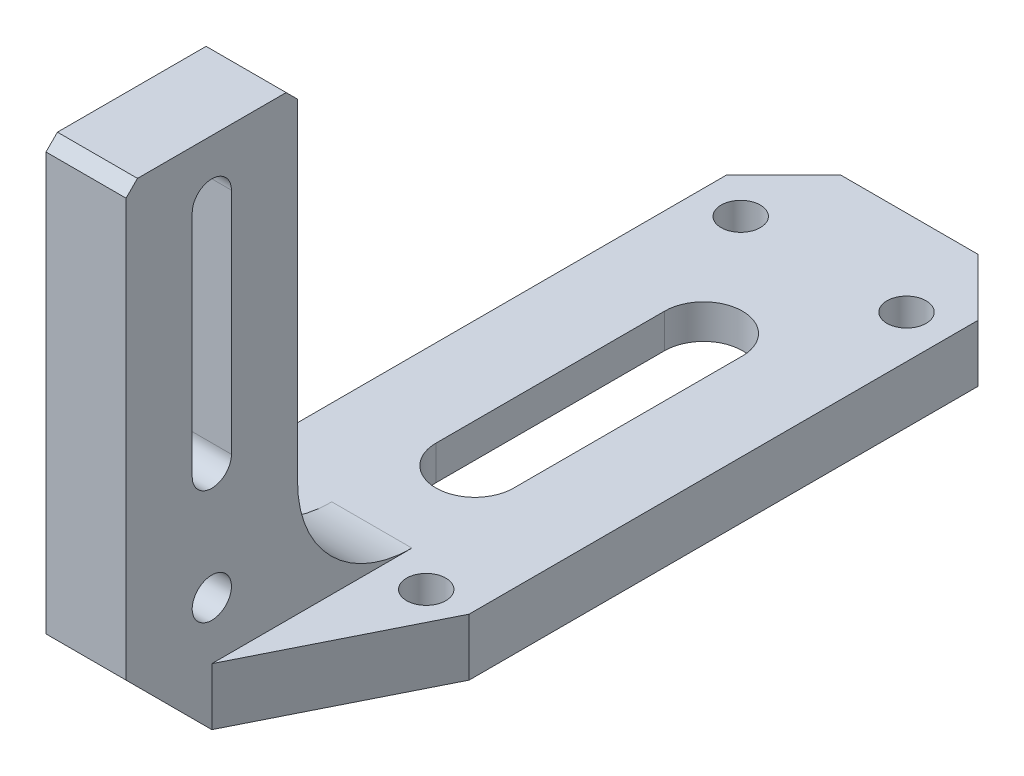
from build123d import *
from OCP.BRepFilletAPI import BRepFilletAPI_MakeChamfer

# Parameters (mm, degrees)
SKETCH1_W           = 22
SKETCH1_H           = 72
BOSS_EXTRUDE1_DEPTH = 5
SKETCH2_W           = 7
SKETCH2_H           = 15
BOSS_EXTRUDE2_DEPTH = 40
CHAMFER1_SIZE       = 1
FILLET1_R           = 10
CUT_EXTRUDE2_DEPTH  = 59.668560575
SKETCH6_W           = 7.5
SKETCH6_H           = 7.5
CUT_EXTRUDE3_DEPTH  = 55.927224579
CHAMFER2_SIZE2      = 15
CHAMFER2_SIZE       = 7.5
CHAMFER7_SIZE       = 7.5
CHAMFER3_SIZE       = 5
CUT_EXTRUDE6_DEPTH  = 2
CUT_EXTRUDE7_DEPTH  = 4
CHAMFER4_SIZE       = 2
CHAMFER4_SIZE_2     = 0.727940469
CUT_EXTRUDE8_DEPTH  = 60.42432162
CHAMFER8_SIZE2      = 7.5
CHAMFER8_SIZE       = 15
SKETCH12_R          = 1.7145
CUT_EXTRUDE9_DEPTH  = 60.42432162
SKETCH13_R          = 1.7145
CUT_EXTRUDE10_DEPTH = 55.927224579


with BuildPart() as part:
    # Sketch1 → Boss-Extrude1 (new body)
    with BuildSketch(Plane(origin=(0, 0, 0), x_dir=(1, 0, 0), z_dir=(0, 1, 0))):
        Rectangle(SKETCH1_W, SKETCH1_H)
    extrude(amount=BOSS_EXTRUDE1_DEPTH)

    # Sketch2 → Boss-Extrude2 (add)
    with BuildSketch(Plane(origin=(0, 5, 0), x_dir=(1, 0, 0), z_dir=(0, 1, 0))):
        with Locations((0, -28.5)):
            Rectangle(SKETCH2_W, SKETCH2_H)
    extrude(amount=BOSS_EXTRUDE2_DEPTH)

    # Chamfer1
    chamfer1_edges = [part.edges().sort_by_distance(p)[0] for p in [
        (0, 45, 36),
        (0, 45, 21),
    ]]
    chamfer(chamfer1_edges, length=CHAMFER1_SIZE)

    # Fillet1
    fillet1_edges = [part.edges().sort_by_distance(p)[0] for p in [
        (0, 5, 21),
    ]]
    fillet(fillet1_edges, radius=FILLET1_R)

    # Sketch5 → Cut-Extrude2 (cut, through all)
    with BuildSketch(Plane.XZ):
        with BuildLine():
            Line((3.4, 2), (3.4, -18))
            ThreePointArc((3.4, -18), (0, -21.4), (-3.4, -18))
            Line((-3.4, -18), (-3.4, 2))
            ThreePointArc((-3.4, 2), (0, 5.4), (3.4, 2))
        make_face()
    extrude(amount=-CUT_EXTRUDE2_DEPTH, mode=Mode.SUBTRACT)

    # Sketch6 → Cut-Extrude3 (cut, through all)
    with BuildSketch(Plane(origin=(0, 5, 0), x_dir=(1, 0, 0), z_dir=(0, 1, 0))):
        with Locations((7.25, -32.25)):
            Rectangle(SKETCH6_W, SKETCH6_H)
    cut_extrude3 = extrude(amount=-CUT_EXTRUDE3_DEPTH, mode=Mode.SUBTRACT)

    # Mirror1: Cut-Extrude3 across plane
    add(cut_extrude3.mirror(Plane(origin=(0, 0, 0), x_dir=(0, 0, 1), z_dir=(1, 0, 0))), mode=Mode.SUBTRACT)

    # Chamfer2
    chamfer2_edges = [part.edges().sort_by_distance(p)[0] for p in [
        (11, 2.5, 28.5),
    ]]
    chamfer2_side = [part.faces().sort_by_distance(p)[0] for p in [
        (10.85, 2.5, 28.5),
    ]]
    chamfer(chamfer2_edges, length=CHAMFER2_SIZE - 0.0001, length2=CHAMFER2_SIZE2 - 0.0001, reference=chamfer2_side[0])  # a hair under: the kernel refuses the full size

    # Chamfer7
    chamfer7_edges = [part.edges().sort_by_distance(p)[0] for p in [
        (0, 0, 36),
    ]]
    chamfer(chamfer7_edges, length=CHAMFER7_SIZE)

    # Chamfer3
    chamfer3_edges = [part.edges().sort_by_distance(p)[0] for p in [
        (-11, 2.5, -36),
        (11, 2.5, -36),
    ]]
    chamfer(chamfer3_edges, length=CHAMFER3_SIZE)

    # Sketch8 → Cut-Extrude6 (cut)
    # profile 1 of 2: a face of its own
    with BuildSketch(Plane.XZ):
        with BuildLine():
            Line((8.5, -18), (8.5, 2))
            ThreePointArc((8.5, 2), (0.500870333, 10.485230045), (-8.440971508, 3))
            Line((-8.440971508, 3), (-6, 3))
            Line((-6, 3), (-6, -19))
            Line((-6, -19), (-8.440971508, -19))
            ThreePointArc((-8.440971508, -19), (0.500870333, -26.485230045), (8.5, -18))
        make_face()
        with BuildLine():
            Line((-3.4, -18), (-3.4, 2))
            ThreePointArc((-3.4, 2), (0, 5.4), (3.4, 2))
            Line((3.4, 2), (3.4, -18))
            ThreePointArc((3.4, -18), (0, -21.4), (-3.4, -18))
        make_face(mode=Mode.SUBTRACT)
    # profile 2 of 2: a face of its own
    with BuildSketch(Plane.XZ):
        with BuildLine():
            Line((-6, 3), (-8.440971508, 3))
            ThreePointArc((-8.440971508, 3), (-8.485230045, 2.500870333), (-8.5, 2))
            Line((-8.5, 2), (-8.5, -18))
            ThreePointArc((-8.5, -18), (-8.485230045, -18.500870333), (-8.440971508, -19))
            Line((-8.440971508, -19), (-6, -19))
            Line((-6, -19), (-6, 3))
        make_face()
    extrude(amount=-CUT_EXTRUDE6_DEPTH, mode=Mode.SUBTRACT)

    # Sketch8<3> → Cut-Extrude7 (cut)
    with BuildSketch(Plane.XZ):
        with BuildLine():
            Line((-6, 3), (-8.440971508, 3))
            ThreePointArc((-8.440971508, 3), (-8.485230045, 2.500870333), (-8.5, 2))
            Line((-8.5, 2), (-8.5, -18))
            ThreePointArc((-8.5, -18), (-8.485230045, -18.500870333), (-8.440971508, -19))
            Line((-8.440971508, -19), (-6, -19))
            Line((-6, -19), (-6, 3))
        make_face()
    extrude(amount=-CUT_EXTRUDE7_DEPTH, mode=Mode.SUBTRACT)

    # Chamfer4
    chamfer4_edges_1 = [part.edges().sort_by_distance(p)[0] for p in [
        (8.5, 0, -8),
    ]]
    chamfer4_side_1 = [part.faces().sort_by_distance(p)[0] for p in [
        (8.5, 0.014558809, -8),
    ]]
    chamfer4_edges_2 = [part.edges().sort_by_distance(p)[0] for p in [
        (0, 0, -26.5),
    ]]
    chamfer4_side_2 = [part.faces().sort_by_distance(p)[0] for p in [
        (0, 0, -26.514558809),
    ]]
    chamfer4_edges_3 = [part.edges().sort_by_distance(p)[0] for p in [
        (0, 0, 10.5),
    ]]
    chamfer4_side_3 = [part.faces().sort_by_distance(p)[0] for p in [
        (0, 0, 10.514558809),
    ]]
    chamfer4_edges_4 = [part.edges().sort_by_distance(p)[0] for p in [
        (-8.5, 0, -8),
    ]]
    chamfer4_side_4 = [part.faces().sort_by_distance(p)[0] for p in [
        (-8.514558809, 0, -8),
    ]]
    chamfer4 = BRepFilletAPI_MakeChamfer(part.part.solid().wrapped)
    for e in chamfer4_edges_1:
        chamfer4.Add(CHAMFER4_SIZE - 0.0001, CHAMFER4_SIZE_2 - 0.0001, e.wrapped, chamfer4_side_1[0].wrapped)
    for e in chamfer4_edges_2:
        chamfer4.Add(CHAMFER4_SIZE - 0.0001, CHAMFER4_SIZE_2 - 0.0001, e.wrapped, chamfer4_side_2[0].wrapped)
    for e in chamfer4_edges_3:
        chamfer4.Add(CHAMFER4_SIZE - 0.0001, CHAMFER4_SIZE_2 - 0.0001, e.wrapped, chamfer4_side_3[0].wrapped)
    for e in chamfer4_edges_4:
        chamfer4.Add(CHAMFER4_SIZE - 0.0001, CHAMFER4_SIZE_2 - 0.0001, e.wrapped, chamfer4_side_4[0].wrapped)
    add(Compound.cast(chamfer4.Shape()), mode=Mode.REPLACE)  # a hair under: the kernel refuses the full size

    # Sketch9 → Cut-Extrude8 (cut, through all)
    with BuildSketch(Plane.ZY.offset(3.5)):
        with BuildLine():
            Line((26.7855, 20), (26.7855, 40))
            ThreePointArc((26.7855, 40), (28.5, 41.7145), (30.2145, 40))
            Line((30.2145, 40), (30.2145, 20))
            ThreePointArc((30.2145, 20), (28.5, 18.2855), (26.7855, 20))
        make_face()
    extrude(amount=-CUT_EXTRUDE8_DEPTH, mode=Mode.SUBTRACT)

    # Chamfer8
    chamfer8_edges = [part.edges().sort_by_distance(p)[0] for p in [
        (-11, 2.5, 28.5),
    ]]
    chamfer8_side = [part.faces().sort_by_distance(p)[0] for p in [
        (-11, 2.5, 28.35),
    ]]
    chamfer(chamfer8_edges, length=CHAMFER8_SIZE - 0.0001, length2=CHAMFER8_SIZE2 - 0.0001, reference=chamfer8_side[0])  # a hair under: the kernel refuses the full size

    # Sketch12 → Cut-Extrude9 (cut, through all)
    with BuildSketch(Plane(origin=(3.5, 0, 0), x_dir=(0, 0, -1), z_dir=(1, 0, 0))):
        with Locations((-28.5, 10)):
            Circle(SKETCH12_R)
    extrude(amount=-CUT_EXTRUDE9_DEPTH, mode=Mode.SUBTRACT)

    # Sketch13 → Cut-Extrude10 (cut, through all)
    with BuildSketch(Plane(origin=(0, 5, 0), x_dir=(1, 0, 0), z_dir=(0, 1, 0))):
        with Locations(Location((-7.25, -13.5, 0), (0, 0, 270))):
            Circle(SKETCH13_R)
        with Locations(Location((7.25, -13.5, 0), (0, 0, 270))):
            Circle(SKETCH13_R)
        with Locations(Location((-7.25, 28.5, 0), (0, 0, 270))):
            Circle(SKETCH13_R)
        with Locations(Location((7.25, 28.5, 0), (0, 0, 270))):
            Circle(SKETCH13_R)
    extrude(amount=-CUT_EXTRUDE10_DEPTH, mode=Mode.SUBTRACT)


solid = part.part
